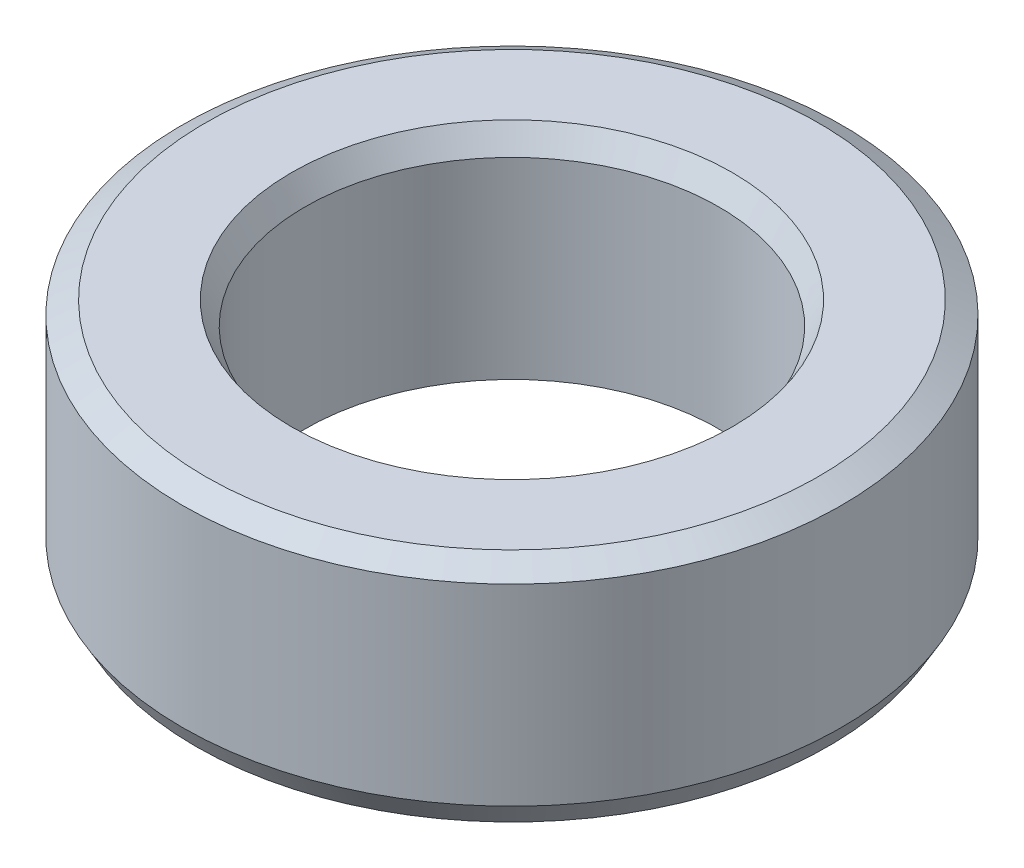
from build123d import *
from OCP.BRepFilletAPI import BRepFilletAPI_MakeChamfer

# Parameters (mm, degrees)
SKETCH1_R           = 20
BOSS_EXTRUDE1_DEPTH = 13.883581781
SKETCH2_R           = 12.562941626
CUT_EXTRUDE1_DEPTH  = 32.507996494
CHAMFER1_SIZE       = 0.809503962
CHAMFER1_SIZE2      = 1.402101991


with BuildPart() as part:
    # Sketch1 → Boss-Extrude1 (new body)
    with BuildSketch(Plane(origin=(0, 0, 0), x_dir=(1, 0, 0), z_dir=(0, 1, 0))):
        Circle(SKETCH1_R)
    extrude(amount=BOSS_EXTRUDE1_DEPTH)

    # Sketch2 → Cut-Extrude1 (cut, through all)
    with BuildSketch(Plane(origin=(0, 0, 0), x_dir=(1, 0, 0), z_dir=(0, 1, 0))):
        Circle(SKETCH2_R)
    extrude(amount=CUT_EXTRUDE1_DEPTH, mode=Mode.SUBTRACT)

    # Chamfer1: one chamfer whose edges measure the first distance from different faces: ONE call of the kernel's chamfer builder (chamfer() names one face for all edges)
    chamfer1_edges_1 = [part.edges().sort_by_distance(p)[0] for p in [
        (-12.562941626, 13.883581781, 0),
    ]]
    chamfer1_side_1 = [part.faces().sort_by_distance(p)[0] for p in [
        (-19.434314575, 13.883581781, 0),
    ]]
    chamfer1_edges_2 = [part.edges().sort_by_distance(p)[0] for p in [
        (-12.562941626, 0, 0),
    ]]
    chamfer1_side_2 = [part.faces().sort_by_distance(p)[0] for p in [
        (-12.562941626, 6.94179089, 0),
    ]]
    chamfer1_edges_3 = [part.edges().sort_by_distance(p)[0] for p in [
        (-20, 0, 0),
    ]]
    chamfer1_side_3 = [part.faces().sort_by_distance(p)[0] for p in [
        (-19.434314575, 0, 0),
    ]]
    chamfer1_edges_4 = [part.edges().sort_by_distance(p)[0] for p in [
        (-20, 13.883581781, 0),
    ]]
    chamfer1_side_4 = [part.faces().sort_by_distance(p)[0] for p in [
        (-20, 6.94179089, 0),
    ]]
    chamfer1 = BRepFilletAPI_MakeChamfer(part.part.solid().wrapped)
    for e in chamfer1_edges_1:
        chamfer1.Add(CHAMFER1_SIZE, CHAMFER1_SIZE2, e.wrapped, chamfer1_side_1[0].wrapped)  # the first distance lies on this face
    for e in chamfer1_edges_2:
        chamfer1.Add(CHAMFER1_SIZE, CHAMFER1_SIZE2, e.wrapped, chamfer1_side_2[0].wrapped)  # the first distance lies on this face
    for e in chamfer1_edges_3:
        chamfer1.Add(CHAMFER1_SIZE, CHAMFER1_SIZE2, e.wrapped, chamfer1_side_3[0].wrapped)  # the first distance lies on this face
    for e in chamfer1_edges_4:
        chamfer1.Add(CHAMFER1_SIZE, CHAMFER1_SIZE2, e.wrapped, chamfer1_side_4[0].wrapped)  # the first distance lies on this face
    add(Compound.cast(chamfer1.Shape()), mode=Mode.REPLACE)


solid = part.part
